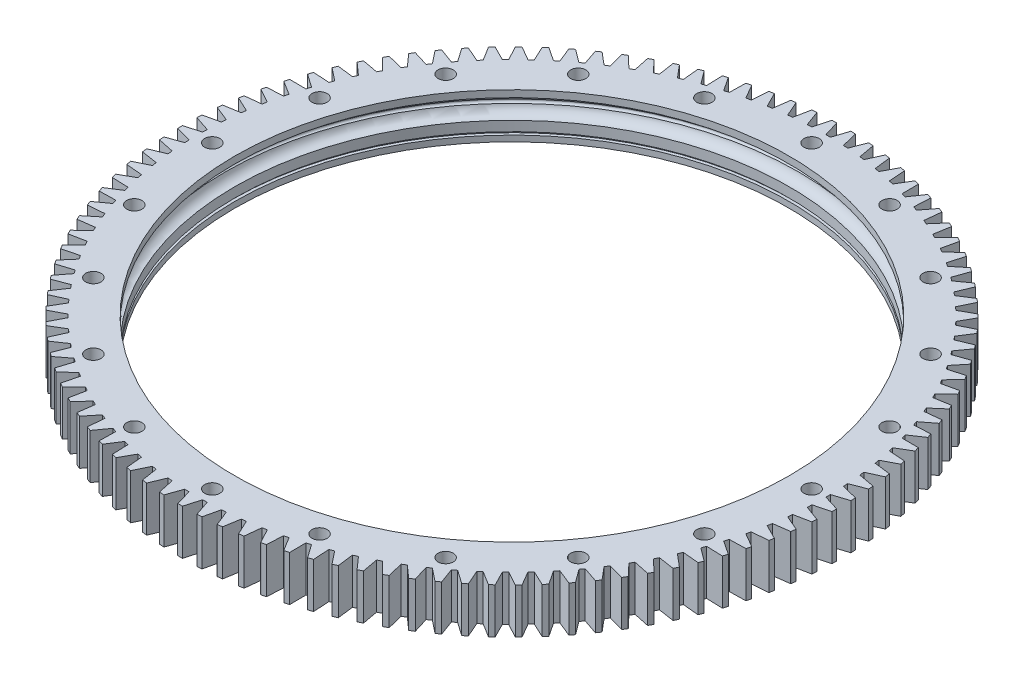
from build123d import *

# Parameters (mm, degrees)
ESQUISSE4_R                  = 7.75
ENL_V_MAT_EXTRU_2_DEPTH      = 477.552536453
R_P_TITION_CIRCULAIRE1_COUNT = 20
ENL_V_MAT_EXTRU_3_DEPTH      = 477.552536453
R_P_TITION_CIRCULAIRE4_COUNT = 109


with BuildPart() as part:
    # Esquisse1 → Révolution1 (revolve)
    with BuildSketch(Plane.XY):
        with BuildLine():
            ThreePointArc((-291.802631579, 21.976970948), (-288.333651811, 27.738530528), (-282, 30))
            Line((-282, 30), (-282, 37))
            Line((-282, 37), (-335.4, 37))
            Line((-335.4, 37), (-335.4, -9))
            Line((-335.4, -9), (-282, -9))
            Line((-282, -9), (-282, -3))
            Line((-282, -3), (-285, -3))
            Line((-285, -3), (-285, 0))
            Line((-285, 0), (-282, 0))
            Line((-282, 0), (-282, 10))
            ThreePointArc((-282, 10), (-288.333651811, 12.261469472), (-291.802631579, 18.023029052))
            ThreePointArc((-291.802631579, 18.023029052), (-293.5, 20), (-291.802631579, 21.976970948))
        make_face()
    revolve(axis=Axis((0, 46, 0), (0, -1, 0)))

    # Esquisse4 → Enlèv. mat.-Extru.2 (cut, through all)
    with BuildSketch(Plane(origin=(0, 37, 0), x_dir=(1, 0, 0), z_dir=(0, 1, 0))):
        with Locations((-305, 0)):
            Circle(ESQUISSE4_R)
    enl_v_mat_extru_2 = extrude(amount=-ENL_V_MAT_EXTRU_2_DEPTH, mode=Mode.SUBTRACT)

    # Répétition circulaire1: Enlèv. mat.-Extru.2 ×20 about axis
    r_p_tition_circulaire1_axis = Axis((0, 45.15, 0), (0, -1, 0))
    for i in range(1, R_P_TITION_CIRCULAIRE1_COUNT):
        add(enl_v_mat_extru_2.rotate(r_p_tition_circulaire1_axis, i * 360 / R_P_TITION_CIRCULAIRE1_COUNT), mode=Mode.SUBTRACT)

    # Esquisse5 → Enlèv. mat.-Extru.3 (cut, through all)
    with BuildSketch(Plane(origin=(0, 37, 0), x_dir=(1, 0, 0), z_dir=(0, 1, 0))):
        Polygon((-334.843591764, -19.311371119), (-387.258576628, -22.334290625), (-387.258576628, 0), (-335.4, 0), (-335.365173302, -4.833273872), (-319.367304086, -9.207338432), (-319.201460028, -13.808617458), align=None)
    enl_v_mat_extru_3 = extrude(amount=-ENL_V_MAT_EXTRU_3_DEPTH, mode=Mode.SUBTRACT)

    # Répétition circulaire4: Enlèv. mat.-Extru.3 ×109 about axis
    r_p_tition_circulaire4_axis = Axis((0, 45.15, 0), (0, -1, 0))
    for i in range(1, R_P_TITION_CIRCULAIRE4_COUNT):
        add(enl_v_mat_extru_3.rotate(r_p_tition_circulaire4_axis, i * 360 / R_P_TITION_CIRCULAIRE4_COUNT), mode=Mode.SUBTRACT)


solid = part.part
